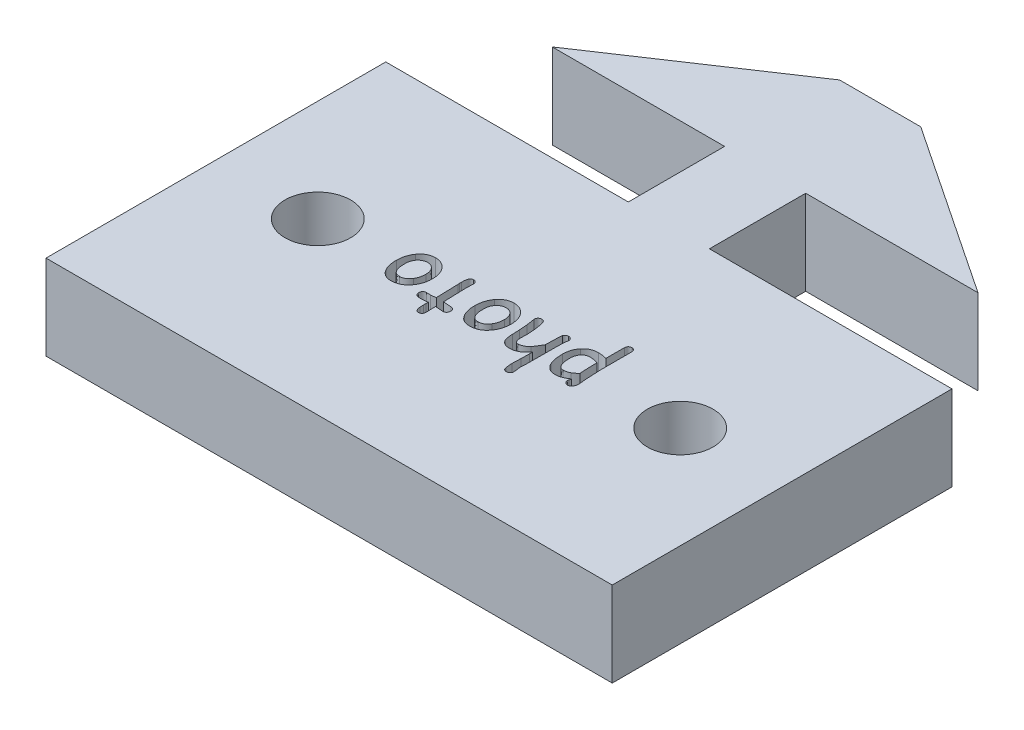
from build123d import *

# Parameters (mm, degrees)
BOSS_EXTRUDE1_DEPTH = 3.75
HOLES_R             = 1.45
CUT_EXTRUDE1_DEPTH  = 22.530864474
CUT_EXTRUDE3_DEPTH  = 1


with BuildPart() as part:
    # Sketch1 → Boss-Extrude1 (new body)
    with BuildSketch(Plane(origin=(0, 0, 0), x_dir=(1, 0, 0), z_dir=(0, 1, 0))):
        Polygon((-9.398, 2.125), (-1.7907, 2.125), (-1.7907, -2.125), (-12.5, -2.125), (-12.5, -17.125), (12.5, -17.125), (12.5, -2.125), (1.7907, -2.125), (1.7907, 2.125), (9.398, 2.125), (1.7907, 7.205), (-1.7907, 7.205), align=None)
    extrude(amount=BOSS_EXTRUDE1_DEPTH)

    # holes → Cut-Extrude1 (cut, through all)
    with BuildSketch(Plane(origin=(0, 3.75, 0), x_dir=(1, 0, 0), z_dir=(0, 1, 0))):
        with Locations((-8, -9.625)):
            Circle(HOLES_R)
        with Locations((8, -9.625)):
            Circle(HOLES_R)
    extrude(amount=-CUT_EXTRUDE1_DEPTH, mode=Mode.SUBTRACT)

    # Sketch9 → Cut-Extrude3 (cut)
    # profile 1 of 5: a face of its own
    with BuildSketch(Plane(origin=(6.778001638, 3.75, 7.630742417), x_dir=(-1, 0, 0), z_dir=(0, 1, 0))):
        with BuildLine():
            add(Edge.make_bspline(
                [(3.457129934, 0.914092976), (3.428175829, 0.914835053), (3.368935457, 0.91635335), (3.27794241, 0.927009986), (3.182942358, 0.943887503), (3.118780126, 0.960012228), (3.085927624, 0.968268449)],
                knots=[0, 0, 0, 0, 0.923672393, 1.889842415, 2.919551984, 4, 4, 4, 4], degree=3))
            Line((3.085927624, 0.968268449), (3.082416251, 0.153629866))
            add(Edge.make_bspline(
                [(3.082416251, 0.153629866), (3.081796386, 0.141552544), (3.080610534, 0.118447653), (3.072684053, 0.085121289), (3.057687395, 0.055882592), (3.038097887, 0.03009964), (3.014255836, 0.008838266), (2.986135461, -0.005947572), (2.955100824, -0.015364012), (2.933169385, -0.016393418), (2.921896333, -0.016922547)],
                knots=[0, 0, 0, 0, 1.104708715, 2.113396988, 3.104903403, 4.086575671, 5.061796572, 5.998998398, 6.971458498, 8, 8, 8, 8], degree=3))
            add(Edge.make_bspline(
                [(2.921896333, -0.016922547), (2.910612944, -0.01642245), (2.888822167, -0.01545665), (2.857932693, -0.005704387), (2.829595865, 0.008653645), (2.805756787, 0.030144017), (2.785953803, 0.055732499), (2.771885274, 0.085347554), (2.763013285, 0.118177616), (2.761935197, 0.14119707), (2.761376415, 0.153128241)],
                knots=[0, 0, 0, 0, 1.031031407, 1.991154914, 2.944156291, 3.921738018, 4.905786729, 5.892934064, 6.9078905, 8, 8, 8, 8], degree=3))
            Line((2.761376415, 0.153128241), (2.761376415, 0.833331393))
            Line((2.761376415, 0.833331393), (2.761376415, 1.51202967))
            add(Edge.make_bspline(
                [(2.761376415, 1.51202967), (2.760009272, 1.572729693), (2.757334731, 1.691477121), (2.751098482, 1.865423117), (2.741490863, 2.030968084), (2.733274251, 2.138402897), (2.729272432, 2.190727948)],
                knots=[0, 0, 0, 0, 1.072117463, 2.097382956, 3.073349405, 4, 4, 4, 4], degree=3))
            Line((2.729272432, 2.190727948), (2.697168448, 2.535845771))
            add(Edge.make_bspline(
                [(2.697168448, 2.535845771), (2.697701608, 2.555280517), (2.698728281, 2.592704784), (2.707832585, 2.646542789), (2.7231722, 2.695760268), (2.738384765, 2.725472964), (2.745826048, 2.740007041)],
                knots=[0, 0, 0, 0, 1.098354967, 2.115033068, 3.077961323, 4, 4, 4, 4], degree=3))
            add(Edge.make_bspline(
                [(2.745826048, 2.740007041), (2.755576605, 2.755380436), (2.774094088, 2.784576368), (2.813679457, 2.8169314), (2.859351081, 2.837468566), (2.892414827, 2.839361901), (2.909355714, 2.84033199)],
                knots=[0, 0, 0, 0, 1.076595489, 2.044584756, 2.998102935, 4, 4, 4, 4], degree=3))
            add(Edge.make_bspline(
                [(2.909355714, 2.84033199), (2.921126631, 2.839617898), (2.944068054, 2.838226138), (2.977191987, 2.828383411), (3.007202501, 2.81161771), (3.032998112, 2.788132131), (3.05496609, 2.761249848), (3.070698177, 2.730999211), (3.08094671, 2.698696384), (3.081920444, 2.676211952), (3.082416251, 2.66476333)],
                knots=[0, 0, 0, 0, 1.03210328, 2.011561124, 3.003357533, 4.02192066, 5.05527447, 6.033082746, 6.998485158, 8, 8, 8, 8], degree=3))
            add(Edge.make_bspline(
                [(3.082416251, 2.66476333), (3.081695061, 2.65755508), (3.079800937, 2.638623404), (3.075530096, 2.620070333), (3.072885381, 2.608581359)],
                knots=[0, 0, 0, 0, 0.76150156, 2, 2, 2, 2], degree=3))
            add(Edge.make_bspline(
                [(3.072885381, 2.608581359), (3.068058674, 2.5919331), (3.058863628, 2.560217584), (3.053066391, 2.527712005), (3.050312267, 2.512269408)],
                knots=[0, 0, 0, 0, 1.049849447, 2, 2, 2, 2], degree=3))
            add(Edge.make_bspline(
                [(3.050312267, 2.512269408), (3.073893598, 2.528073467), (3.119824696, 2.558856197), (3.189575141, 2.59958055), (3.258099985, 2.633953965), (3.325447036, 2.662189339), (3.391451783, 2.684453075), (3.456247246, 2.700046953), (3.519343339, 2.710196895), (3.561097313, 2.711351138), (3.58153287, 2.711916056)],
                knots=[0, 0, 0, 0, 1.182556088, 2.303351709, 3.362657688, 4.374438386, 5.343787428, 6.261305571, 7.149034564, 8, 8, 8, 8], degree=3))
            add(Edge.make_bspline(
                [(3.58153287, 2.711916056), (3.609177724, 2.710916928), (3.662834896, 2.708977674), (3.740483186, 2.695001773), (3.812152989, 2.67047507), (3.878410132, 2.637021587), (3.938385351, 2.592811166), (3.992864199, 2.539792845), (4.041632668, 2.477020098), (4.067734858, 2.429729974), (4.081151114, 2.405423338)],
                knots=[0, 0, 0, 0, 1.069716051, 2.076261269, 3.04013056, 3.992306881, 4.937198566, 5.911954987, 6.926766422, 8, 8, 8, 8], degree=3))
            add(Edge.make_bspline(
                [(4.081151114, 2.405423338), (4.091151583, 2.384487928), (4.111556541, 2.341771316), (4.137126911, 2.273531734), (4.158468035, 2.200379743), (4.176025936, 2.122304846), (4.189460614, 2.039543791), (4.198750277, 1.951786077), (4.205001433, 1.859244165), (4.205698959, 1.79579281), (4.206055675, 1.763343667)],
                knots=[0, 0, 0, 0, 0.843351231, 1.720773962, 2.646158207, 3.612290593, 4.628838685, 5.69305293, 6.820222867, 8, 8, 8, 8], degree=3))
            add(Edge.make_bspline(
                [(4.206055675, 1.763343667), (4.205476442, 1.733728525), (4.204338095, 1.675526884), (4.195436129, 1.590236765), (4.17948257, 1.509036777), (4.158990926, 1.431554177), (4.130866414, 1.358378332), (4.097562365, 1.288883711), (4.0570763, 1.223786307), (4.025987356, 1.183547083), (4.010422026, 1.163400474)],
                knots=[0, 0, 0, 0, 1.103340681, 2.168358356, 3.189809911, 4.184268486, 5.150418414, 6.10612732, 7.051793042, 8, 8, 8, 8], degree=3))
            add(Edge.make_bspline(
                [(4.010422026, 1.163400474), (3.992779253, 1.143594756), (3.958015175, 1.104568718), (3.899166716, 1.053670721), (3.836263223, 1.01009558), (3.768633229, 0.974866922), (3.696686281, 0.947652708), (3.620679856, 0.928094694), (3.540260547, 0.91639276), (3.485260247, 0.914871193), (3.457129934, 0.914092976)],
                knots=[0, 0, 0, 0, 1.012789697, 1.995644336, 2.965197324, 3.931269493, 4.902064109, 5.898637068, 6.925242267, 8, 8, 8, 8], degree=3))
        make_face()
        with BuildLine():
            add(Edge.make_bspline(
                [(3.585044243, 2.358772237), (3.559901988, 2.358087929), (3.51062664, 2.356746781), (3.438727892, 2.343617146), (3.370286359, 2.323111474), (3.328124287, 2.302039892), (3.307144136, 2.291554521)],
                knots=[0, 0, 0, 0, 1.043481768, 2.045080161, 3.027217797, 4, 4, 4, 4], degree=3))
            add(Edge.make_bspline(
                [(3.307144136, 2.291554521), (3.29124911, 2.282295619), (3.256410604, 2.262002081), (3.20374925, 2.222502413), (3.144303915, 2.174381577), (3.103956699, 2.137619034), (3.082416251, 2.11799236)],
                knots=[0, 0, 0, 0, 0.775129439, 1.698918484, 2.771505614, 4, 4, 4, 4], degree=3))
            add(Edge.make_bspline(
                [(3.082416251, 2.11799236), (3.087399826, 2.055142245), (3.097479037, 1.928028788), (3.107151521, 1.734832078), (3.113417787, 1.536985886), (3.114149745, 1.403516514), (3.114520234, 1.335959385)],
                knots=[0, 0, 0, 0, 0.966299621, 1.954327129, 2.964558057, 4, 4, 4, 4], degree=3))
            add(Edge.make_bspline(
                [(3.114520234, 1.335959385), (3.144450999, 1.325385607), (3.203422146, 1.304552598), (3.29394609, 1.282960101), (3.384524207, 1.270129668), (3.445050795, 1.268198413), (3.475188425, 1.267236796)],
                knots=[0, 0, 0, 0, 1.031483431, 2.032282264, 3.020226471, 4, 4, 4, 4], degree=3))
            add(Edge.make_bspline(
                [(3.475188425, 1.267236796), (3.491932656, 1.267739656), (3.524570222, 1.268719822), (3.572070336, 1.275730572), (3.616337173, 1.287756857), (3.657659554, 1.30450002), (3.695825829, 1.326020048), (3.730886415, 1.35267067), (3.763238257, 1.383574713), (3.781487413, 1.407592383), (3.790710388, 1.419730718)],
                knots=[0, 0, 0, 0, 1.10070075, 2.145466763, 3.148207675, 4.109726495, 5.069672921, 6.019494381, 6.999068546, 8, 8, 8, 8], degree=3))
            add(Edge.make_bspline(
                [(3.790710388, 1.419730718), (3.798290462, 1.431135131), (3.813493499, 1.454008487), (3.832533461, 1.491254506), (3.849204237, 1.530541466), (3.861962483, 1.572687336), (3.872878155, 1.616802423), (3.879401339, 1.663709388), (3.884257328, 1.712912466), (3.884759157, 1.746609462), (3.88501584, 1.763845291)],
                knots=[0, 0, 0, 0, 0.905881947, 1.816889532, 2.764616945, 3.72741659, 4.72889317, 5.769964229, 6.85934892, 8, 8, 8, 8], degree=3))
            add(Edge.make_bspline(
                [(3.88501584, 1.763845291), (3.884868017, 1.787927197), (3.884581438, 1.834614038), (3.88111578, 1.902235351), (3.875010524, 1.965135495), (3.867206731, 2.023441428), (3.856879056, 2.077109825), (3.843665009, 2.125950334), (3.829019126, 2.17028214), (3.811250913, 2.209617995), (3.791698329, 2.244825164), (3.76947685, 2.275390032), (3.744247848, 2.300721646), (3.717696529, 2.322603559), (3.687552533, 2.338219301), (3.655822933, 2.350963224), (3.62105533, 2.357104025), (3.597267303, 2.358206004), (3.585044243, 2.358772237)],
                knots=[0, 0, 0, 0, 1.557506388, 3.019489214, 4.377576042, 5.643990508, 6.823269027, 7.909353017, 8.914854788, 9.839455964, 10.696640695, 11.51644137, 12.273566762, 13.004918102, 13.730811519, 14.459920427, 15.208657221, 16, 16, 16, 16], degree=3))
        make_face(mode=Mode.SUBTRACT)
    # profile 2 of 5: a face of its own
    with BuildSketch(Plane(origin=(6.778001638, 3.75, 7.630742417), x_dir=(-1, 0, 0), z_dir=(0, 1, 0))):
        with BuildLine():
            add(Edge.make_bspline(
                [(5.996354384, 0.881988993), (5.986945369, 0.882310147), (5.968918844, 0.88292544), (5.943281898, 0.889425466), (5.919679804, 0.898666771), (5.899047253, 0.913000374), (5.881114613, 0.931173465), (5.86537488, 0.952827949), (5.852949578, 0.97899666), (5.846658094, 0.997955027), (5.843358837, 1.007896803)],
                knots=[0, 0, 0, 0, 1.047165879, 2.006242056, 2.93453571, 3.860578042, 4.783798501, 5.772523552, 6.831910358, 8, 8, 8, 8], degree=3))
            add(Edge.make_bspline(
                [(5.843358837, 1.007896803), (5.836603432, 1.032753524), (5.821864893, 1.086984426), (5.803381723, 1.176292525), (5.785282156, 1.279838975), (5.775056907, 1.35381208), (5.76962, 1.393144606)],
                knots=[0, 0, 0, 0, 0.787220145, 1.717509726, 2.786368233, 4, 4, 4, 4], degree=3))
            add(Edge.make_bspline(
                [(5.76962, 1.393144606), (5.764871149, 1.431243269), (5.75582276, 1.503835887), (5.746572028, 1.607576755), (5.739852583, 1.700553709), (5.738945234, 1.758986325), (5.738519266, 1.786418405)],
                knots=[0, 0, 0, 0, 1.167075247, 2.2237276, 3.166101912, 4, 4, 4, 4], degree=3))
            add(Edge.make_bspline(
                [(5.738519266, 1.786418405), (5.738706624, 1.794611075), (5.739119562, 1.812667753), (5.73931734, 1.842616455), (5.741273679, 1.877872305), (5.742359578, 1.917022626), (5.744477967, 1.956128633), (5.746208898, 1.991568557), (5.746453981, 2.021515231), (5.746861835, 2.039572127), (5.747046886, 2.047764896)],
                knots=[0, 0, 0, 0, 0.752098149, 1.657627229, 2.748147411, 3.992005123, 5.251852589, 6.342372771, 7.247901851, 8, 8, 8, 8], degree=3))
            add(Edge.make_bspline(
                [(5.747046886, 2.047764896), (5.746612606, 2.07202712), (5.745798513, 2.11750864), (5.738704608, 2.181151856), (5.725850189, 2.235075183), (5.708758001, 2.279968085), (5.685627537, 2.315254878), (5.656408708, 2.340709796), (5.621474721, 2.356010091), (5.596373678, 2.357836679), (5.58351722, 2.358772237)],
                knots=[0, 0, 0, 0, 1.485432309, 2.784564191, 3.911937346, 4.872045253, 5.712582115, 6.467720011, 7.215184251, 8, 8, 8, 8], degree=3))
            add(Edge.make_bspline(
                [(5.58351722, 2.358772237), (5.565257151, 2.358192281), (5.529012603, 2.357041124), (5.4753837, 2.347831728), (5.423683233, 2.332066779), (5.37315838, 2.310689606), (5.32419261, 2.283118082), (5.276648083, 2.249113356), (5.231029322, 2.208852517), (5.20270776, 2.17859738), (5.188236922, 2.163138587)],
                knots=[0, 0, 0, 0, 0.96249006, 1.910453745, 2.85882736, 3.806996033, 4.797821738, 5.815584114, 6.883877656, 8, 8, 8, 8], degree=3))
            add(Edge.make_bspline(
                [(5.188236922, 2.163138587), (5.180483355, 2.153825502), (5.163721085, 2.133691744), (5.138204363, 2.100228058), (5.11132234, 2.060696258), (5.081516595, 2.016119846), (5.050015081, 1.965364017), (5.016728012, 1.908816518), (4.98079775, 1.846954118), (4.9568977, 1.803524562), (4.944447297, 1.780900533)],
                knots=[0, 0, 0, 0, 0.640494328, 1.384670992, 2.22311523, 3.166835858, 4.218889429, 5.379932048, 6.635111667, 8, 8, 8, 8], degree=3))
            add(Edge.make_bspline(
                [(4.944447297, 1.780900533), (4.944500368, 1.755651861), (4.944603347, 1.706658817), (4.943878097, 1.63509557), (4.943634369, 1.567538572), (4.942388357, 1.503837486), (4.941648709, 1.444134716), (4.939905732, 1.388463758), (4.938653202, 1.336614139), (4.936438373, 1.288806384), (4.93467499, 1.244807236), (4.93194333, 1.204866871), (4.929761519, 1.168873731), (4.926459295, 1.136976704), (4.923812751, 1.108979478), (4.920004239, 1.084796893), (4.91700676, 1.064408134), (4.913773388, 1.052354628), (4.912343314, 1.047023533)],
                knots=[0, 0, 0, 0, 1.647662041, 3.197157481, 4.670273228, 6.056227037, 7.354899041, 8.566536601, 9.690915145, 10.739344295, 11.689662353, 12.564299171, 13.351831458, 14.042377196, 14.656927982, 15.186228298, 15.640080284, 16, 16, 16, 16], degree=3))
            add(Edge.make_bspline(
                [(4.912343314, 1.047023533), (4.903761248, 1.031748414), (4.887491693, 1.002790422), (4.851331532, 0.969243619), (4.807052483, 0.949809118), (4.775254686, 0.947426471), (4.758846142, 0.94619696)],
                knots=[0, 0, 0, 0, 1.077006814, 2.04174868, 2.989488129, 4, 4, 4, 4], degree=3))
            add(Edge.make_bspline(
                [(4.758846142, 0.94619696), (4.747075803, 0.946734658), (4.724005961, 0.947788545), (4.690896218, 0.957314389), (4.660090409, 0.972102988), (4.632370072, 0.992500336), (4.608993511, 1.017012821), (4.59173424, 1.044974985), (4.581349608, 1.075574594), (4.579963638, 1.096941547), (4.579264484, 1.107720127)],
                knots=[0, 0, 0, 0, 1.053949873, 2.065739793, 3.065446871, 4.106614611, 5.136044385, 6.085410312, 7.03418344, 8, 8, 8, 8], degree=3))
            add(Edge.make_bspline(
                [(4.579264484, 1.107720127), (4.579508572, 1.112078622), (4.580075827, 1.122207705), (4.583480614, 1.138888574), (4.587764176, 1.159276762), (4.592328752, 1.17363742), (4.594814851, 1.181458965)],
                knots=[0, 0, 0, 0, 0.692413619, 1.609160145, 2.697827002, 4, 4, 4, 4], degree=3))
            add(Edge.make_bspline(
                [(4.594814851, 1.181458965), (4.595872812, 1.185795258), (4.598377817, 1.196062591), (4.60112628, 1.214193054), (4.604236813, 1.237243011), (4.60661913, 1.265368569), (4.608453511, 1.298666007), (4.610608959, 1.336944894), (4.611910295, 1.3802688), (4.6128692, 1.410701802), (4.613374967, 1.426753464)],
                knots=[0, 0, 0, 0, 0.434655842, 1.029163752, 1.784824142, 2.700660271, 3.777734417, 5.033710745, 6.435452648, 8, 8, 8, 8], degree=3))
            Line((4.613374967, 1.426753464), (4.618391214, 1.675559337))
            Line((4.618391214, 1.675559337), (4.623407462, 2.910559454))
            add(Edge.make_bspline(
                [(4.623407462, 2.910559454), (4.624430045, 2.927279173), (4.626382909, 2.959209431), (4.628871473, 3.004858813), (4.630975737, 3.046156049), (4.632288537, 3.083291903), (4.633961794, 3.116217971), (4.634952235, 3.144980022), (4.635537552, 3.1693954), (4.6354747, 3.184279134), (4.635446456, 3.190967686)],
                knots=[0, 0, 0, 0, 1.432192152, 2.735109681, 3.908792944, 4.9675816, 5.912105795, 6.727491315, 7.428151542, 8, 8, 8, 8], degree=3))
            add(Edge.make_bspline(
                [(4.635446456, 3.190967686), (4.634838106, 3.218797208), (4.633648381, 3.273222314), (4.619449131, 3.352833931), (4.605243173, 3.431595594), (4.603980476, 3.485015826), (4.603342472, 3.512007521)],
                knots=[0, 0, 0, 0, 1.032171678, 2.018577639, 2.998844675, 4, 4, 4, 4], degree=3))
            add(Edge.make_bspline(
                [(4.603342472, 3.512007521), (4.603842297, 3.523288882), (4.604823951, 3.545445392), (4.614859159, 3.57677115), (4.63010842, 3.605383622), (4.65187354, 3.629700423), (4.67782861, 3.64961131), (4.706943465, 3.664666442), (4.739136041, 3.673266093), (4.761471878, 3.674436939), (4.772891635, 3.675035563)],
                knots=[0, 0, 0, 0, 1.028895958, 2.020744066, 2.979001064, 3.976142203, 4.979598125, 5.957789486, 6.95586867, 8, 8, 8, 8], degree=3))
            add(Edge.make_bspline(
                [(4.772891635, 3.675035563), (4.783944717, 3.674480788), (4.805086684, 3.673419633), (4.835366142, 3.667424427), (4.861276382, 3.654775179), (4.8842161, 3.638599038), (4.902696733, 3.616976975), (4.91822423, 3.591161573), (4.929582992, 3.560521134), (4.93375199, 3.538174076), (4.935919677, 3.526554639)],
                knots=[0, 0, 0, 0, 1.086266306, 2.077774059, 3.002809325, 3.895694347, 4.81430162, 5.771251386, 6.841153751, 8, 8, 8, 8], degree=3))
            add(Edge.make_bspline(
                [(4.935919677, 3.526554639), (4.940154844, 3.499998991), (4.948418335, 3.448184654), (4.956760614, 3.372189891), (4.962189438, 3.300067866), (4.962739557, 3.253345478), (4.963007413, 3.23059604)],
                knots=[0, 0, 0, 0, 1.084422051, 2.115881676, 3.08261039, 4, 4, 4, 4], degree=3))
            add(Edge.make_bspline(
                [(4.963007413, 3.23059604), (4.962423739, 3.170220919), (4.961229987, 3.046739415), (4.95477098, 2.923420347), (4.951470044, 2.86039698)],
                knots=[0, 0, 0, 0, 0.977881219, 2, 2, 2, 2], degree=3))
            add(Edge.make_bspline(
                [(4.951470044, 2.86039698), (4.948419361, 2.798876865), (4.942303916, 2.675552703), (4.942729261, 2.552077607), (4.942942423, 2.490197919)],
                knots=[0, 0, 0, 0, 0.997697683, 2, 2, 2, 2], degree=3))
            Line((4.942942423, 2.490197919), (4.944447297, 2.341215371))
            add(Edge.make_bspline(
                [(4.944447297, 2.341215371), (4.967775943, 2.370816429), (5.013004235, 2.42820533), (5.088382169, 2.503410529), (5.165241508, 2.567976736), (5.244969002, 2.620582468), (5.327158195, 2.661966593), (5.412353069, 2.6903861), (5.499767178, 2.709078848), (5.559176735, 2.710967066), (5.589035092, 2.711916056)],
                knots=[0, 0, 0, 0, 1.170811254, 2.269904351, 3.303577438, 4.286900056, 5.233107975, 6.155350049, 7.072906448, 8, 8, 8, 8], degree=3))
            add(Edge.make_bspline(
                [(5.589035092, 2.711916056), (5.611956415, 2.711259861), (5.656107596, 2.709995895), (5.719698718, 2.702585741), (5.777336852, 2.687463812), (5.830048576, 2.66856873), (5.876519804, 2.642428448), (5.918141187, 2.611692452), (5.95348648, 2.574250851), (5.972342809, 2.545674383), (5.981807266, 2.531331148)],
                knots=[0, 0, 0, 0, 1.213619999, 2.33768173, 3.378720794, 4.361714729, 5.292654887, 6.190052387, 7.091542644, 8, 8, 8, 8], degree=3))
            add(Edge.make_bspline(
                [(5.981807266, 2.531331148), (5.988119353, 2.51993015), (6.00138989, 2.495960678), (6.016190129, 2.455333616), (6.030478311, 2.410076868), (6.042482002, 2.35913032), (6.051685807, 2.30260783), (6.058961462, 2.24082219), (6.065368179, 2.173781946), (6.067155681, 2.127204183), (6.068086722, 2.102943618)],
                knots=[0, 0, 0, 0, 0.708403734, 1.489348761, 2.347287602, 3.292220559, 4.335220822, 5.463100633, 6.678626652, 8, 8, 8, 8], degree=3))
            Line((6.068086722, 2.102943618), (6.079624091, 1.783408656))
            Line((6.079624091, 1.783408656), (6.108718326, 1.435782709))
            add(Edge.make_bspline(
                [(6.108718326, 1.435782709), (6.112336175, 1.404173483), (6.119366594, 1.342748544), (6.130592447, 1.253524157), (6.143614128, 1.170241899), (6.153575136, 1.11689493), (6.158379176, 1.091166511)],
                knots=[0, 0, 0, 0, 1.096211355, 2.130223421, 3.098235649, 4, 4, 4, 4], degree=3))
            add(Edge.make_bspline(
                [(6.158379176, 1.091166511), (6.160129443, 1.0823336), (6.163315581, 1.066254417), (6.1640622, 1.049885676), (6.164398673, 1.042508911)],
                knots=[0, 0, 0, 0, 1.098676475, 2, 2, 2, 2], degree=3))
            add(Edge.make_bspline(
                [(6.164398673, 1.042508911), (6.163906742, 1.031394905), (6.162947643, 1.009726298), (6.152885573, 0.978938136), (6.136908727, 0.951175859), (6.115422772, 0.927019973), (6.089992943, 0.906640157), (6.06091021, 0.892718196), (6.029499859, 0.883631533), (6.007623083, 0.882547419), (5.996354384, 0.881988993)],
                knots=[0, 0, 0, 0, 1.028312573, 2.004866883, 2.971010927, 3.982563467, 4.9882678, 5.973657665, 6.956233697, 8, 8, 8, 8], degree=3))
        make_face()
    # profile 3 of 5: a face of its own
    with BuildSketch(Plane(origin=(6.778001638, 3.75, 7.630742417), x_dir=(-1, 0, 0), z_dir=(0, 1, 0))):
        with BuildLine():
            add(Edge.make_bspline(
                [(7.219315507, 0.881988993), (7.195877939, 0.882737359), (7.149645597, 0.884213567), (7.081480125, 0.893722951), (7.015971145, 0.910454898), (6.952893626, 0.933583383), (6.892340813, 0.963566614), (6.833901798, 0.999588086), (6.778572791, 1.043052535), (6.744499074, 1.075976792), (6.727221634, 1.092671385)],
                knots=[0, 0, 0, 0, 1.021936028, 2.015844633, 2.993660309, 3.96471241, 4.939588425, 5.93493984, 6.952889361, 8, 8, 8, 8], degree=3))
            add(Edge.make_bspline(
                [(6.727221634, 1.092671385), (6.708695853, 1.112681185), (6.67174505, 1.152591953), (6.624636881, 1.219500412), (6.584312035, 1.291172093), (6.550670161, 1.367824538), (6.52345564, 1.449387497), (6.503542094, 1.536065118), (6.490405793, 1.627708505), (6.487119284, 1.690565799), (6.485438508, 1.722712062)],
                knots=[0, 0, 0, 0, 0.946116291, 1.887086724, 2.833488076, 3.798045474, 4.789613185, 5.815016051, 6.882562958, 8, 8, 8, 8], degree=3))
            add(Edge.make_bspline(
                [(6.485438508, 1.722712062), (6.4852941, 1.754329544), (6.485009408, 1.816661728), (6.492855757, 1.908709323), (6.506593859, 1.997852746), (6.527958618, 2.083998631), (6.55547926, 2.167415361), (6.589694602, 2.248031369), (6.63077501, 2.32563307), (6.663260051, 2.374414383), (6.679567284, 2.398902216)],
                knots=[0, 0, 0, 0, 1.059647505, 2.089038685, 3.093690888, 4.080859116, 5.06125424, 6.03591004, 7.014042396, 8, 8, 8, 8], degree=3))
            add(Edge.make_bspline(
                [(6.679567284, 2.398902216), (6.699864519, 2.426316653), (6.739597981, 2.479982606), (6.808414585, 2.550734902), (6.883274066, 2.61051737), (6.96396359, 2.659583366), (7.050739252, 2.697470126), (7.143219311, 2.724639374), (7.24165177, 2.740883079), (7.30921196, 2.742959502), (7.343718444, 2.744020039)],
                knots=[0, 0, 0, 0, 1.047403948, 2.050377052, 3.02303666, 3.98451488, 4.944027433, 5.924487965, 6.939928641, 8, 8, 8, 8], degree=3))
            add(Edge.make_bspline(
                [(7.343718444, 2.744020039), (7.371378047, 2.743084084), (7.425258907, 2.741260843), (7.503361632, 2.726247787), (7.576475861, 2.702286667), (7.644187485, 2.667789449), (7.706750343, 2.623562533), (7.763542063, 2.569162641), (7.815803491, 2.505578229), (7.844918923, 2.457655129), (7.859890304, 2.433012699)],
                knots=[0, 0, 0, 0, 1.045104825, 2.035862449, 2.995530429, 3.945570091, 4.898088907, 5.88198425, 6.91089986, 8, 8, 8, 8], degree=3))
            add(Edge.make_bspline(
                [(7.859890304, 2.433012699), (7.871109124, 2.411778483), (7.89374961, 2.368926117), (7.921529706, 2.300976024), (7.94505346, 2.229860909), (7.965006019, 2.155801582), (7.978488222, 2.078165923), (7.988724813, 1.997675769), (7.994293647, 1.913911664), (7.994314922, 1.856987677), (7.994325736, 1.828053258)],
                knots=[0, 0, 0, 0, 0.919115307, 1.854849133, 2.806416187, 3.786315242, 4.788446437, 5.820799411, 6.892314012, 8, 8, 8, 8], degree=3))
            add(Edge.make_bspline(
                [(7.994325736, 1.828053258), (7.993422643, 1.797261458), (7.991641239, 1.736522789), (7.981523398, 1.647301977), (7.965227309, 1.56156701), (7.944123009, 1.478968722), (7.915520622, 1.400286186), (7.882555819, 1.324340337), (7.843108187, 1.252108921), (7.81212306, 1.206961936), (7.796685587, 1.184468713)],
                knots=[0, 0, 0, 0, 1.080421114, 2.131195299, 3.145982461, 4.14057752, 5.118423245, 6.079782707, 7.043305443, 8, 8, 8, 8], degree=3))
            add(Edge.make_bspline(
                [(7.796685587, 1.184468713), (7.778298195, 1.160463915), (7.742281577, 1.113444108), (7.680814376, 1.051632608), (7.614884314, 0.999134618), (7.544413575, 0.95637457), (7.469467323, 0.922771619), (7.389970801, 0.899458475), (7.306183318, 0.884155665), (7.248646225, 0.882720565), (7.219315507, 0.881988993)],
                knots=[0, 0, 0, 0, 1.068197389, 2.092349874, 3.072849248, 4.041082034, 4.999063882, 5.967892042, 6.964091153, 8, 8, 8, 8], degree=3))
        make_face()
        with BuildLine():
            add(Edge.make_bspline(
                [(7.313119334, 2.39087622), (7.292509597, 2.390220773), (7.252179005, 2.388938149), (7.193533328, 2.378339601), (7.138510267, 2.360011258), (7.08694295, 2.334251952), (7.038837382, 2.300747048), (6.994672184, 2.259610408), (6.953444641, 2.211656906), (6.930273937, 2.175327617), (6.918340662, 2.156617465)],
                knots=[0, 0, 0, 0, 1.024881853, 2.005561264, 2.952602806, 3.901287093, 4.863587821, 5.858558907, 6.897124343, 8, 8, 8, 8], degree=3))
            add(Edge.make_bspline(
                [(6.918340662, 2.156617465), (6.909457785, 2.140665635), (6.891693151, 2.108763983), (6.868386995, 2.059015686), (6.849587062, 2.007355717), (6.833902077, 1.954069856), (6.821227179, 1.899347686), (6.813055633, 1.842615492), (6.807035732, 1.78454143), (6.806665459, 1.745134316), (6.806478344, 1.725220186)],
                knots=[0, 0, 0, 0, 0.971279991, 1.942437749, 2.919121343, 3.893086569, 4.896627775, 5.904418626, 6.941011511, 8, 8, 8, 8], degree=3))
            add(Edge.make_bspline(
                [(6.806478344, 1.725220186), (6.806789109, 1.705467793), (6.807394032, 1.667018503), (6.814227536, 1.611181694), (6.824419921, 1.55869022), (6.83969727, 1.509710566), (6.858801866, 1.463842185), (6.881664946, 1.420993751), (6.909580489, 1.381770111), (6.931435749, 1.358625811), (6.942418649, 1.34699513)],
                knots=[0, 0, 0, 0, 1.147770894, 2.234209124, 3.265628186, 4.252662135, 5.211331006, 6.150882324, 7.070764843, 8, 8, 8, 8], degree=3))
            add(Edge.make_bspline(
                [(6.942418649, 1.34699513), (6.951992457, 1.338159512), (6.970858239, 1.32074838), (7.000907903, 1.297418304), (7.032812313, 1.278229961), (7.066078333, 1.262874099), (7.100124349, 1.249899692), (7.135760891, 1.241728251), (7.172291616, 1.235696708), (7.197217994, 1.235321815), (7.209784637, 1.235132812)],
                knots=[0, 0, 0, 0, 1.050252192, 2.069587155, 3.061537252, 4.044651841, 5.021459592, 5.992668475, 6.988002984, 8, 8, 8, 8], degree=3))
            add(Edge.make_bspline(
                [(7.209784637, 1.235132812), (7.224520524, 1.235499314), (7.253450634, 1.236218845), (7.29612888, 1.2424915), (7.337062459, 1.252514037), (7.37688467, 1.266054482), (7.414696876, 1.284249868), (7.451373634, 1.305908723), (7.485912303, 1.332147889), (7.507406236, 1.351998104), (7.518283854, 1.362043872)],
                knots=[0, 0, 0, 0, 1.032153118, 2.026366298, 3.015318322, 3.982442994, 4.967779094, 5.950394518, 6.96273866, 8, 8, 8, 8], degree=3))
            add(Edge.make_bspline(
                [(7.518283854, 1.362043872), (7.53009917, 1.374000455), (7.553583101, 1.397765169), (7.58388403, 1.437871123), (7.609280944, 1.481187022), (7.631124062, 1.527279983), (7.648850018, 1.576412303), (7.661013674, 1.628999293), (7.669771672, 1.684330625), (7.672097319, 1.722345391), (7.6732859, 1.741773803)],
                knots=[0, 0, 0, 0, 0.957839204, 1.903785849, 2.857200609, 3.816936526, 4.809232438, 5.829182757, 6.890548709, 8, 8, 8, 8], degree=3))
            add(Edge.make_bspline(
                [(7.6732859, 1.741773803), (7.674050475, 1.767856688), (7.675535648, 1.81852223), (7.673373297, 1.892010146), (7.668468128, 1.96047757), (7.660727266, 2.023864868), (7.649161927, 2.082169596), (7.634713893, 2.135523978), (7.617366376, 2.184060747), (7.596233028, 2.227407427), (7.572097246, 2.265816226), (7.545089148, 2.299518888), (7.51387541, 2.327217664), (7.480063489, 2.350742328), (7.44282419, 2.36883488), (7.402199797, 2.381322039), (7.358774005, 2.38966382), (7.328542718, 2.390466638), (7.313119334, 2.39087622)],
                knots=[0, 0, 0, 0, 1.488804211, 2.891975717, 4.193170963, 5.405098924, 6.533501151, 7.582106894, 8.557104944, 9.470335503, 10.328041367, 11.141732595, 11.92544346, 12.700920796, 13.486140472, 14.276791061, 15.120854078, 16, 16, 16, 16], degree=3))
        make_face(mode=Mode.SUBTRACT)
    # profile 4 of 5: a face of its own
    with BuildSketch(Plane(origin=(6.778001638, 3.75, 7.630742417), x_dir=(-1, 0, 0), z_dir=(0, 1, 0))):
        with BuildLine():
            add(Edge.make_bspline(
                [(9.55789006, 2.410439585), (9.54467724, 2.410688558), (9.515892614, 2.411230956), (9.471776758, 2.413931249), (9.427663846, 2.416685214), (9.399045776, 2.417216867), (9.385832773, 2.417462332)],
                knots=[0, 0, 0, 0, 0.920717115, 2.005816965, 3.079282885, 4, 4, 4, 4], degree=3))
            add(Edge.make_bspline(
                [(9.385832773, 2.417462332), (9.38165213, 2.41730675), (9.371780537, 2.41693938), (9.354539332, 2.415957373), (9.332470185, 2.413836561), (9.305378613, 2.410833996), (9.273479981, 2.406670646), (9.236651704, 2.402324663), (9.195064945, 2.396599095), (9.165623154, 2.392854486), (9.150069144, 2.39087622)],
                knots=[0, 0, 0, 0, 0.423045876, 0.998922293, 1.745956013, 2.664623774, 3.755177246, 4.998829415, 6.414490547, 8, 8, 8, 8], degree=3))
            Line((9.150069144, 2.39087622), (9.180668253, 1.405685225))
            Line((9.180668253, 1.405685225), (9.182173127, 1.331946387))
            Line((9.182173127, 1.331946387), (9.184179626, 1.247171806))
            add(Edge.make_bspline(
                [(9.184179626, 1.247171806), (9.18434634, 1.218562871), (9.184657008, 1.165250697), (9.177764847, 1.090654321), (9.165406873, 1.027315611), (9.146990298, 0.975063559), (9.123426086, 0.933222562), (9.09182129, 0.903737696), (9.054323643, 0.884582025), (9.026729935, 0.882866151), (9.012623964, 0.881988993)],
                knots=[0, 0, 0, 0, 1.528621386, 2.848555227, 3.998559243, 4.968438543, 5.802376151, 6.536002899, 7.251601123, 8, 8, 8, 8], degree=3))
            add(Edge.make_bspline(
                [(9.012623964, 0.881988993), (9.002018028, 0.88235209), (8.98110786, 0.883067955), (8.951379938, 0.892295991), (8.923266521, 0.905444923), (8.898302945, 0.924298706), (8.876961382, 0.947195931), (8.861711014, 0.973810865), (8.852204315, 1.003084865), (8.851141519, 1.023541979), (8.850599172, 1.03398129)],
                knots=[0, 0, 0, 0, 1.02652806, 2.023854815, 2.99735258, 4.030413798, 5.0421858, 6.01730832, 6.988227997, 8, 8, 8, 8], degree=3))
            add(Edge.make_bspline(
                [(8.850599172, 1.03398129), (8.850746331, 1.045853408), (8.851075913, 1.072442603), (8.852112271, 1.116084997), (8.853699125, 1.167750071), (8.855425153, 1.224612188), (8.858248035, 1.28160021), (8.859559763, 1.333281665), (8.860670617, 1.376921542), (8.860989852, 1.403343855), (8.861133292, 1.415216095)],
                knots=[0, 0, 0, 0, 0.747128177, 1.673293467, 2.746990194, 3.999802079, 5.253011562, 6.337225674, 7.252871823, 8, 8, 8, 8], degree=3))
            Line((8.861133292, 1.415216095), (8.829029308, 2.39087622))
            add(Edge.make_bspline(
                [(8.829029308, 2.39087622), (8.818324742, 2.391321182), (8.795561775, 2.39226738), (8.759631323, 2.394979476), (8.71966922, 2.397986038), (8.675857551, 2.401468739), (8.628037936, 2.40550915), (8.576374132, 2.410062956), (8.520662812, 2.414927953), (8.482234074, 2.418911593), (8.462341621, 2.420973705)],
                knots=[0, 0, 0, 0, 0.69876017, 1.485894292, 2.349961702, 3.312734694, 4.352486331, 5.480100212, 6.695585878, 8, 8, 8, 8], degree=3))
            add(Edge.make_bspline(
                [(8.462341621, 2.420973705), (8.450718895, 2.423143197), (8.428731547, 2.427247343), (8.398246272, 2.438445185), (8.372121875, 2.453870142), (8.351323468, 2.474525223), (8.334830961, 2.498641822), (8.323075342, 2.52692593), (8.31692064, 2.559494748), (8.315900904, 2.582472946), (8.315365571, 2.594535866)],
                knots=[0, 0, 0, 0, 1.119713667, 2.118223711, 3.064630397, 3.972940108, 4.874581196, 5.819924503, 6.855520493, 8, 8, 8, 8], degree=3))
            add(Edge.make_bspline(
                [(8.315365571, 2.594535866), (8.315932659, 2.606962658), (8.317027729, 2.630959293), (8.325761183, 2.665165519), (8.339956502, 2.695853595), (8.359659582, 2.72274481), (8.384089325, 2.744503582), (8.411786026, 2.761315372), (8.443142236, 2.771109549), (8.465116858, 2.772103088), (8.476387114, 2.77261265)],
                knots=[0, 0, 0, 0, 1.10983231, 2.143130888, 3.132909426, 4.116573268, 5.101031898, 6.039351675, 6.994430595, 8, 8, 8, 8], degree=3))
            Line((8.476387114, 2.77261265), (8.829029308, 2.744020039))
            add(Edge.make_bspline(
                [(8.829029308, 2.744020039), (8.828927474, 2.759738904), (8.828707516, 2.793690834), (8.826879119, 2.848358821), (8.825238508, 2.910421942), (8.821555605, 2.976776613), (8.817819096, 3.041789095), (8.816200229, 3.099673155), (8.814347513, 3.147482881), (8.814092879, 3.175917672), (8.813980566, 3.188459562)],
                knots=[0, 0, 0, 0, 0.848238914, 1.8321519, 2.951624046, 4.198441437, 5.418224434, 6.465550233, 7.323191773, 8, 8, 8, 8], degree=3))
            add(Edge.make_bspline(
                [(8.813980566, 3.188459562), (8.814531381, 3.19989257), (8.815610876, 3.22229915), (8.824828176, 3.254058546), (8.839842641, 3.282879934), (8.860916122, 3.307442601), (8.885963752, 3.328160675), (8.914171437, 3.343468651), (8.945391991, 3.352288141), (8.966920422, 3.353415112), (8.978011857, 3.353995727)],
                knots=[0, 0, 0, 0, 1.054098555, 2.065838051, 3.025944053, 4.034260515, 5.032715164, 6.013703489, 6.976661236, 8, 8, 8, 8], degree=3))
            add(Edge.make_bspline(
                [(8.978011857, 3.353995727), (8.989807394, 3.353235009), (9.012674051, 3.351760292), (9.045261317, 3.339854891), (9.072634907, 3.318685265), (9.097032975, 3.290857047), (9.116147235, 3.254465233), (9.131466874, 3.210641874), (9.143532244, 3.159187472), (9.147799356, 3.121974604), (9.150069144, 3.102180106)],
                knots=[0, 0, 0, 0, 0.839179043, 1.626820346, 2.427236251, 3.279915469, 4.244758927, 5.33359862, 6.581671405, 8, 8, 8, 8], degree=3))
            add(Edge.make_bspline(
                [(9.150069144, 3.102180106), (9.151648323, 3.078946569), (9.155099109, 3.028177196), (9.155090215, 2.977287357), (9.155085391, 2.949686184)],
                knots=[0, 0, 0, 0, 0.915257976, 2, 2, 2, 2], degree=3))
            Line((9.155085391, 2.949686184), (9.151574018, 2.850364485))
            Line((9.151574018, 2.850364485), (9.150069144, 2.744020039))
            add(Edge.make_bspline(
                [(9.150069144, 2.744020039), (9.16678899, 2.746199871), (9.198213074, 2.750296751), (9.242505536, 2.755977983), (9.281187788, 2.760159283), (9.314195679, 2.764770401), (9.341908413, 2.766581531), (9.363706439, 2.769707752), (9.379977046, 2.770523096), (9.388842786, 2.770941912), (9.392353895, 2.771107776)],
                knots=[0, 0, 0, 0, 1.659498559, 3.118941497, 4.394719153, 5.488798678, 6.397639186, 7.126385805, 7.654021676, 8, 8, 8, 8], degree=3))
            add(Edge.make_bspline(
                [(9.392353895, 2.771107776), (9.406398404, 2.770909613), (9.433317221, 2.770529798), (9.471798166, 2.770474549), (9.506554886, 2.768537182), (9.537534153, 2.767461854), (9.564643626, 2.764938775), (9.587821245, 2.761661633), (9.607430176, 2.759268228), (9.618946161, 2.7560125), (9.624104526, 2.754554159)],
                knots=[0, 0, 0, 0, 1.447613272, 2.774609975, 3.964759937, 5.034410691, 5.968933724, 6.76833278, 7.448298163, 8, 8, 8, 8], degree=3))
            add(Edge.make_bspline(
                [(9.624104526, 2.754554159), (9.632455651, 2.75153701), (9.648685385, 2.745673425), (9.669783885, 2.731692573), (9.688090145, 2.715369039), (9.702422188, 2.695501581), (9.714352208, 2.673173095), (9.722155278, 2.647454978), (9.72729404, 2.618988711), (9.727720268, 2.59890831), (9.727940848, 2.588516369)],
                knots=[0, 0, 0, 0, 1.005767345, 1.954627295, 2.855857429, 3.779451047, 4.722967414, 5.720622874, 6.820384471, 8, 8, 8, 8], degree=3))
            add(Edge.make_bspline(
                [(9.727940848, 2.588516369), (9.727433312, 2.576071406), (9.726451511, 2.55199732), (9.716825828, 2.517782443), (9.702611747, 2.486396576), (9.680961268, 2.459995503), (9.655782381, 2.437724388), (9.626119684, 2.42174724), (9.59312265, 2.411920943), (9.569831629, 2.41094167), (9.55789006, 2.410439585)],
                knots=[0, 0, 0, 0, 1.079895878, 2.088998209, 3.071435682, 4.05505688, 5.03479875, 5.978573441, 6.963591752, 8, 8, 8, 8], degree=3))
        make_face()
    # profile 5 of 5: a face of its own
    with BuildSketch(Plane(origin=(6.778001638, 3.75, 7.630742417), x_dir=(-1, 0, 0), z_dir=(0, 1, 0))):
        with BuildLine():
            add(Edge.make_bspline(
                [(10.686545732, 0.881988993), (10.663108164, 0.882737359), (10.616875821, 0.884213567), (10.548710349, 0.893722951), (10.483201369, 0.910454898), (10.420123851, 0.933583383), (10.359571037, 0.963566614), (10.301132023, 0.999588086), (10.245803016, 1.043052535), (10.211729298, 1.075976792), (10.194451859, 1.092671385)],
                knots=[0, 0, 0, 0, 1.021936028, 2.015844633, 2.993660309, 3.96471241, 4.939588425, 5.93493984, 6.952889361, 8, 8, 8, 8], degree=3))
            add(Edge.make_bspline(
                [(10.194451859, 1.092671385), (10.175926077, 1.112681185), (10.138975274, 1.152591953), (10.091867105, 1.219500412), (10.05154226, 1.291172093), (10.017900385, 1.367824538), (9.990685864, 1.449387497), (9.970772319, 1.536065118), (9.957636017, 1.627708505), (9.954349508, 1.690565799), (9.952668733, 1.722712062)],
                knots=[0, 0, 0, 0, 0.946116291, 1.887086724, 2.833488076, 3.798045474, 4.789613185, 5.815016051, 6.882562958, 8, 8, 8, 8], degree=3))
            add(Edge.make_bspline(
                [(9.952668733, 1.722712062), (9.952524325, 1.754329544), (9.952239632, 1.816661728), (9.960085981, 1.908709323), (9.973824083, 1.997852746), (9.995188842, 2.083998631), (10.022709484, 2.167415361), (10.056924826, 2.248031369), (10.098005235, 2.32563307), (10.130490275, 2.374414383), (10.146797508, 2.398902216)],
                knots=[0, 0, 0, 0, 1.059647505, 2.089038685, 3.093690888, 4.080859116, 5.06125424, 6.03591004, 7.014042396, 8, 8, 8, 8], degree=3))
            add(Edge.make_bspline(
                [(10.146797508, 2.398902216), (10.167094743, 2.426316653), (10.206828205, 2.479982606), (10.275644809, 2.550734902), (10.350504291, 2.61051737), (10.431193815, 2.659583366), (10.517969476, 2.697470126), (10.610449536, 2.724639374), (10.708881994, 2.740883079), (10.776442185, 2.742959502), (10.810948668, 2.744020039)],
                knots=[0, 0, 0, 0, 1.047403948, 2.050377052, 3.02303666, 3.98451488, 4.944027433, 5.924487965, 6.939928641, 8, 8, 8, 8], degree=3))
            add(Edge.make_bspline(
                [(10.810948668, 2.744020039), (10.838608271, 2.743084084), (10.892489131, 2.741260843), (10.970591856, 2.726247787), (11.043706086, 2.702286667), (11.11141771, 2.667789449), (11.173980567, 2.623562533), (11.230772288, 2.569162641), (11.283033715, 2.505578229), (11.312149148, 2.457655129), (11.327120529, 2.433012699)],
                knots=[0, 0, 0, 0, 1.045104825, 2.035862449, 2.995530429, 3.945570091, 4.898088907, 5.88198425, 6.91089986, 8, 8, 8, 8], degree=3))
            add(Edge.make_bspline(
                [(11.327120529, 2.433012699), (11.338339348, 2.411778483), (11.360979834, 2.368926117), (11.38875993, 2.300976024), (11.412283684, 2.229860909), (11.432236243, 2.155801582), (11.445718446, 2.078165923), (11.455955038, 1.997675769), (11.461523871, 1.913911664), (11.461545146, 1.856987677), (11.46155596, 1.828053258)],
                knots=[0, 0, 0, 0, 0.919115307, 1.854849133, 2.806416187, 3.786315242, 4.788446437, 5.820799411, 6.892314012, 8, 8, 8, 8], degree=3))
            add(Edge.make_bspline(
                [(11.46155596, 1.828053258), (11.460652868, 1.797261458), (11.458871463, 1.736522789), (11.448753623, 1.647301977), (11.432457534, 1.56156701), (11.411353233, 1.478968722), (11.382750847, 1.400286186), (11.349786044, 1.324340337), (11.310338412, 1.252108921), (11.279353284, 1.206961936), (11.263915811, 1.184468713)],
                knots=[0, 0, 0, 0, 1.080421114, 2.131195299, 3.145982461, 4.14057752, 5.118423245, 6.079782707, 7.043305443, 8, 8, 8, 8], degree=3))
            add(Edge.make_bspline(
                [(11.263915811, 1.184468713), (11.245528419, 1.160463915), (11.209511801, 1.113444108), (11.148044601, 1.051632608), (11.082114538, 0.999134618), (11.0116438, 0.95637457), (10.936697547, 0.922771619), (10.857201025, 0.899458475), (10.773413543, 0.884155665), (10.715876449, 0.882720565), (10.686545732, 0.881988993)],
                knots=[0, 0, 0, 0, 1.068197389, 2.092349874, 3.072849248, 4.041082034, 4.999063882, 5.967892042, 6.964091153, 8, 8, 8, 8], degree=3))
        make_face()
        with BuildLine():
            add(Edge.make_bspline(
                [(10.780349559, 2.39087622), (10.759739821, 2.390220773), (10.71940923, 2.388938149), (10.660763553, 2.378339601), (10.605740491, 2.360011258), (10.554173175, 2.334251952), (10.506067607, 2.300747048), (10.461902408, 2.259610408), (10.420674866, 2.211656906), (10.397504161, 2.175327617), (10.385570886, 2.156617465)],
                knots=[0, 0, 0, 0, 1.024881853, 2.005561264, 2.952602806, 3.901287093, 4.863587821, 5.858558907, 6.897124343, 8, 8, 8, 8], degree=3))
            add(Edge.make_bspline(
                [(10.385570886, 2.156617465), (10.37668801, 2.140665635), (10.358923375, 2.108763983), (10.33561722, 2.059015686), (10.316817287, 2.007355717), (10.301132301, 1.954069856), (10.288457403, 1.899347686), (10.280285858, 1.842615492), (10.274265957, 1.78454143), (10.273895684, 1.745134316), (10.273708568, 1.725220186)],
                knots=[0, 0, 0, 0, 0.971279991, 1.942437749, 2.919121343, 3.893086569, 4.896627775, 5.904418626, 6.941011511, 8, 8, 8, 8], degree=3))
            add(Edge.make_bspline(
                [(10.273708568, 1.725220186), (10.274019333, 1.705467793), (10.274624256, 1.667018503), (10.28145776, 1.611181694), (10.291650146, 1.55869022), (10.306927494, 1.509710566), (10.326032091, 1.463842185), (10.348895171, 1.420993751), (10.376810713, 1.381770111), (10.398665973, 1.358625811), (10.409648874, 1.34699513)],
                knots=[0, 0, 0, 0, 1.147770894, 2.234209124, 3.265628186, 4.252662135, 5.211331006, 6.150882324, 7.070764843, 8, 8, 8, 8], degree=3))
            add(Edge.make_bspline(
                [(10.409648874, 1.34699513), (10.419222682, 1.338159512), (10.438088464, 1.32074838), (10.468138128, 1.297418304), (10.500042538, 1.278229961), (10.533308557, 1.262874099), (10.567354574, 1.249899692), (10.602991115, 1.241728251), (10.639521841, 1.235696708), (10.664448218, 1.235321815), (10.677014862, 1.235132812)],
                knots=[0, 0, 0, 0, 1.050252192, 2.069587155, 3.061537252, 4.044651841, 5.021459592, 5.992668475, 6.988002984, 8, 8, 8, 8], degree=3))
            add(Edge.make_bspline(
                [(10.677014862, 1.235132812), (10.691750748, 1.235499314), (10.720680859, 1.236218845), (10.763359105, 1.2424915), (10.804292684, 1.252514037), (10.844114895, 1.266054482), (10.8819271, 1.284249868), (10.918603858, 1.305908723), (10.953142527, 1.332147889), (10.974636461, 1.351998104), (10.985514079, 1.362043872)],
                knots=[0, 0, 0, 0, 1.032153118, 2.026366298, 3.015318322, 3.982442994, 4.967779094, 5.950394518, 6.96273866, 8, 8, 8, 8], degree=3))
            add(Edge.make_bspline(
                [(10.985514079, 1.362043872), (10.997329394, 1.374000455), (11.020813326, 1.397765169), (11.051114255, 1.437871123), (11.076511169, 1.481187022), (11.098354286, 1.527279983), (11.116080243, 1.576412303), (11.128243898, 1.628999293), (11.137001897, 1.684330625), (11.139327544, 1.722345391), (11.140516125, 1.741773803)],
                knots=[0, 0, 0, 0, 0.957839204, 1.903785849, 2.857200609, 3.816936526, 4.809232438, 5.829182757, 6.890548709, 8, 8, 8, 8], degree=3))
            add(Edge.make_bspline(
                [(11.140516125, 1.741773803), (11.141280699, 1.767856688), (11.142765872, 1.81852223), (11.140603522, 1.892010146), (11.135698353, 1.96047757), (11.12795749, 2.023864868), (11.116392151, 2.082169596), (11.101944118, 2.135523978), (11.084596601, 2.184060747), (11.063463253, 2.227407427), (11.03932747, 2.265816226), (11.012319373, 2.299518888), (10.981105635, 2.327217664), (10.947293713, 2.350742328), (10.910054415, 2.36883488), (10.869430022, 2.381322039), (10.82600423, 2.38966382), (10.795772943, 2.390466638), (10.780349559, 2.39087622)],
                knots=[0, 0, 0, 0, 1.488804211, 2.891975717, 4.193170963, 5.405098924, 6.533501151, 7.582106894, 8.557104944, 9.470335503, 10.328041367, 11.141732595, 11.92544346, 12.700920796, 13.486140472, 14.276791061, 15.120854078, 16, 16, 16, 16], degree=3))
        make_face(mode=Mode.SUBTRACT)
    extrude(amount=-CUT_EXTRUDE3_DEPTH, mode=Mode.SUBTRACT)


solid = part.part
